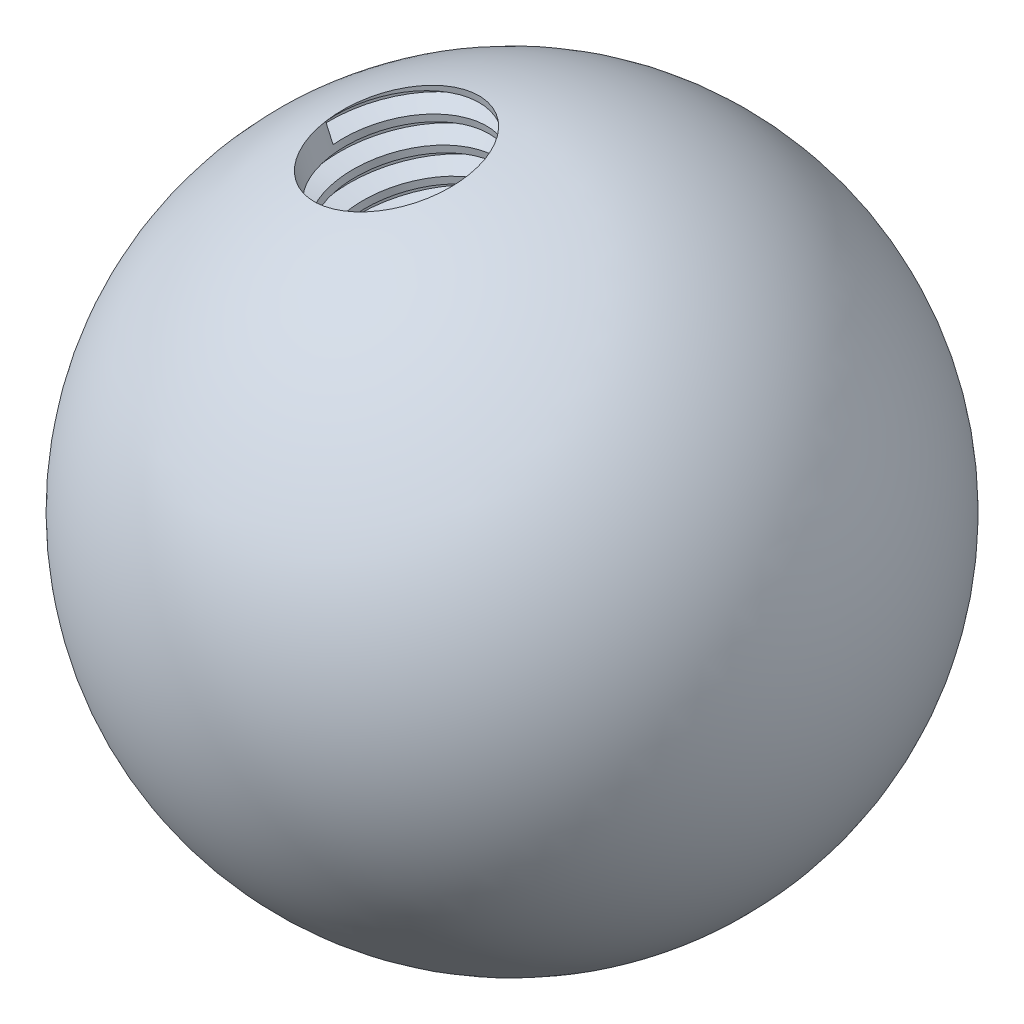
from build123d import *

# Parameters (mm, degrees)
FILETTATURA1_PITCH = 1.25


with BuildPart() as part:
    # Schizzo1 → Rivoluzione1 (revolve)
    with BuildSketch(Plane.XY):
        with BuildLine():
            Line((0.663556424, 14.985315908), (-0.663556424, -14.985315908))
            ThreePointArc((-0.663556424, -14.985315908), (-14.985315908, 0.663556424), (0.663556424, 14.985315908))
        make_face()
    revolve(axis=Axis((0.663556424, 14.985315908, 0), (-0.044237094932313946, -0.999021060554756, 0)))

    # Schizzo2 → Preforo da maschiare M8x1.25-1 (revolve, cut)
    with BuildSketch(Plane(origin=(-2.901516903, 14.502881143, 2.499527597), x_dir=(-0.680275757507728, -0.2545587908916996, 0.6873315908111914), z_dir=(0.7069710060228755, 0.019595746630497193, 0.7069710060228757))):
        Polygon((0, 0), (0, 15), (3.4, 12.957073895), (3.4, 0), align=None)
    revolve(axis=Axis((-4.129825725, 20.642434161, 3.557660946), (0.1934344601933443, -0.9668587428853035, -0.16663517310568068)), mode=Mode.SUBTRACT)

    # Filettatura1: the profile of Profilo filettatura1 profile screwed along a right-hand helix of 12 turns, 8 arcs to a turn; built about Z, then put on its axis
    filettatura1_z = Axis((0, 0, 0), (0, 0, 1))
    filettatura1_corners = [(3.3997, -1e-09, -0.000173204), (4.076582344, -1e-09, 0.390624999), (4.076582344, -1e-09, 0.546874999), (3.3997, -1e-09, 0.937673203)]
    with BuildLine(mode=Mode.PRIVATE) as filettatura1_profile:
        Line(filettatura1_corners[0], filettatura1_corners[1])
        Line(filettatura1_corners[1], filettatura1_corners[2])
        Line(filettatura1_corners[2], filettatura1_corners[3])
        Line(filettatura1_corners[3], filettatura1_corners[0])
    filettatura1_cap = Face(filettatura1_profile.wire())
    filettatura1_turn_angles = [0, 22.5, 45, 67.5, 90, 112.5, 135, 157.5, 180, 202.5, 225, 247.5, 270, 292.5, 315, 337.5, 360]
    filettatura1_turn_weights = [1, 0.9238795325112867, 1, 0.9238795325112867, 1, 0.9238795325112867, 1, 0.9238795325112867, 1, 0.9238795325112867, 1, 0.9238795325112867, 1, 0.9238795325112867, 1, 0.9238795325112867, 1]
    filettatura1_turn_rails = [Edge.make_bspline([Vector(p[0], p[1], 0).rotate(filettatura1_z, filettatura1_turn_angles[k]) / filettatura1_turn_weights[k] + Vector(0, 0, p[2] + FILETTATURA1_PITCH * filettatura1_turn_angles[k] / 360) for k in range(17)], [0, 0, 0, 1, 1, 2, 2, 3, 3, 4, 4, 5, 5, 6, 6, 7, 7, 8, 8, 8], 2, filettatura1_turn_weights) for p in filettatura1_corners]
    filettatura1_turn_sides = [Face.make_surface_from_curves(filettatura1_turn_rails[p[0]], filettatura1_turn_rails[p[1]]) for p in [(0, 1), (1, 2), (2, 3), (3, 0)]]
    filettatura1 = Plane(origin=(-2.825997361, 14.125405852, 2.434470874), x_dir=(-0.981113199, -0.190624078, -0.032853482), z_dir=(0.19343446, -0.966858743, -0.166635173)) * Solid(Shell([*[p.moved(Location((0, 0, FILETTATURA1_PITCH * i))) for i in range(12) for p in filettatura1_turn_sides], filettatura1_cap, filettatura1_cap.rotate(filettatura1_z, 4320).moved(Location((0, 0, FILETTATURA1_PITCH * 4320 / 360)))]))
    add(filettatura1, mode=Mode.SUBTRACT)


solid = part.part
